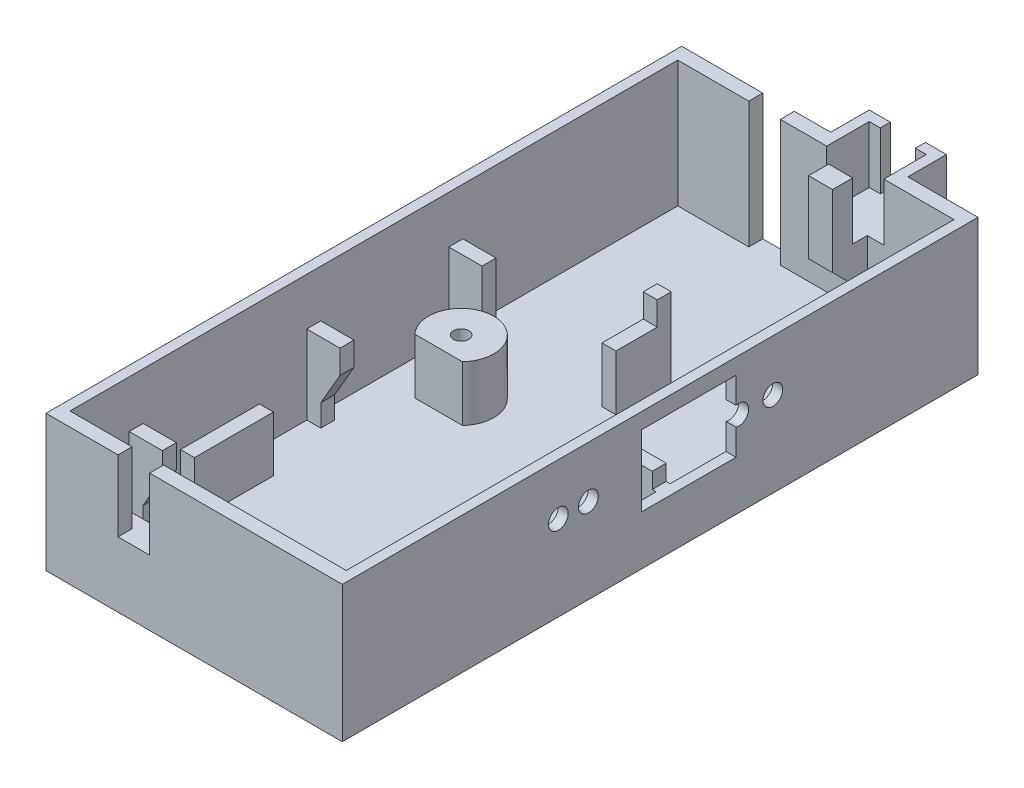
from build123d import *

# Parameters (mm, degrees)
BOSS_EXTRUDE1_DEPTH            = 77
SKETCH3_W                      = 37.54
SKETCH3_H                      = 17.27
BOSS_EXTRUDE2_DEPTH            = 1.77
SKETCH4_W                      = 37.54
SKETCH4_H                      = 17.27
BOSS_EXTRUDE3_DEPTH            = 1.77
SKETCH5_W                      = 4
SKETCH5_H                      = 16
CUT_EXTRUDE2_DEPTH             = 1.77
SKETCH6_W                      = 9.78
SKETCH6_H                      = 11.05
SKETCH6_W_2                    = 7.24
SKETCH6_H_2                    = 7.24
BUTTON_WALLS_DEPTH             = 7.24
SKETCH7_W                      = 9.78
SKETCH7_H                      = 11.05
BUTTON_BOTTOM_DEPTH            = 1.27
SKETCH8_W                      = 7.24
SKETCH8_H                      = 1.77
BUTTON_CUTOUT_MIDDLE_DEPTH     = 7.24
SKETCH9_W                      = 4.45
SKETCH9_H                      = 1.27
SKETCH9_W_2                    = 3.37
SKETCH9_H_2                    = 4.39
BUTTON_CUTOUT_FRONT_BACK_DEPTH = 7.24
SKETCH10_W                     = 3.37
SKETCH10_H                     = 4.39
BUTTON_CUTOUT_BOTTOM_DEPTH     = 1.27
BUTTON_CHAMFER1_SIZE           = 5
SKETCH12_W                     = 35
SKETCH12_H                     = 1.77
SKETCH12_W_2                   = 1.77
SKETCH12_H_2                   = 10
SKETCH12_W_3                   = 7.5
SKETCH12_R                     = 0.9652
SKETCH12_H_3                   = 7
SUPPORT_PCB_BATTERY_DEPTH      = 7
SKETCH13_R                     = 1.25
SKETCH13_W                     = 12
SKETCH13_H                     = 9
CUTOUT_USB_3_LEDS_DEPTH        = 1.77
SKETCH16_W                     = 1.77
SKETCH16_H                     = 1.77
TAB_PCB_RETAINER_LEN_DEPTH     = 3
SKETCH17_W                     = 4
SKETCH17_H                     = 1.77
CUTOUT_BACK_MOT_WIRES_DEPTH    = 9
SKETCH18_R                     = 1.25
CUTOUT_CHG_DONE_LED_DEPTH      = 10
SKETCH19_W                     = 4.2
SKETCH19_H                     = 1.77
TAB_PCB_RETAINERS_WIDTH_DEPTH  = 10
CUTOUT_RETAINER_TAB_1_DEPTH    = 1.77
CUTOUT_RETAINER_TAB_2_DEPTH    = 1.77


with BuildPart() as part:
    # Sketch2 → Boss-Extrude1 (new body)
    with BuildSketch(Plane.XY):
        Polygon((-30.215355805, 3.088014981), (-30.215355805, -12.911985019), (4.784644195, -12.911985019), (4.784644195, 3.088014981), (6.054644195, 3.088014981), (6.054644195, -14.181985019), (-31.485355805, -14.181985019), (-31.485355805, 3.088014981), align=None)
    extrude(amount=BOSS_EXTRUDE1_DEPTH)

    # Sketch3 → Boss-Extrude2 (add)
    with BuildSketch(Plane.XY.offset(77)):
        with Locations((-12.715355805, -5.546985019)):
            Rectangle(SKETCH3_W, SKETCH3_H)
    extrude(amount=BOSS_EXTRUDE2_DEPTH)

    # Sketch4 → Boss-Extrude3 (add)
    with BuildSketch(Plane(origin=(0, 0, 0), x_dir=(-1, 0, 0), z_dir=(0, 0, -1))):
        with Locations((12.715355805, -5.546985019)):
            Rectangle(SKETCH4_W, SKETCH4_H)
    extrude(amount=BOSS_EXTRUDE3_DEPTH)

    # Sketch5 → Cut-Extrude2 (cut)
    with BuildSketch(Plane(origin=(0, 0, -1.77), x_dir=(-1, 0, 0), z_dir=(0, 0, -1))):
        with Locations((19.215355805, -4.911985019)):
            Rectangle(SKETCH5_W, SKETCH5_H)
    extrude(amount=-CUT_EXTRUDE2_DEPTH, mode=Mode.SUBTRACT)

    # Sketch6 → button_walls (add)
    with BuildSketch(Plane(origin=(0, 3.088014981, 0), x_dir=(1, 0, 0), z_dir=(0, 1, 0))):
        with Locations((-7.725355805, 1.135)):
            Rectangle(SKETCH6_W, SKETCH6_H)
        with Locations((-7.725355805, 1.77)):
            Rectangle(SKETCH6_W_2, SKETCH6_H_2, mode=Mode.SUBTRACT)
    extrude(amount=-BUTTON_WALLS_DEPTH)

    # Sketch7 → button_bottom (add)
    with BuildSketch(Plane.XZ.offset(4.151985019)):
        with Locations((-7.725355805, -1.135)):
            Rectangle(SKETCH7_W, SKETCH7_H)
    extrude(amount=BUTTON_BOTTOM_DEPTH)

    # Sketch8 → button_cutout_middle (cut)
    with BuildSketch(Plane(origin=(0, 3.088014981, 0), x_dir=(1, 0, 0), z_dir=(0, 1, 0))):
        with Locations((-7.725355805, 0.885)):
            Rectangle(SKETCH8_W, SKETCH8_H)
    extrude(amount=-BUTTON_CUTOUT_MIDDLE_DEPTH, mode=Mode.SUBTRACT)

    # Sketch9 → button_cutout_front_back (cut)
    with BuildSketch(Plane(origin=(0, 3.088014981, 0), x_dir=(1, 0, 0), z_dir=(0, 1, 0))):
        with Locations((-7.720355805, 6.025)):
            Rectangle(SKETCH9_W, SKETCH9_H)
        with Locations((-10.930355805, -2.195)):
            Rectangle(SKETCH9_W_2, SKETCH9_H_2)
        with Locations((-4.520355805, -2.195)):
            Rectangle(SKETCH9_W_2, SKETCH9_H_2)
    extrude(amount=-BUTTON_CUTOUT_FRONT_BACK_DEPTH, mode=Mode.SUBTRACT)

    # Sketch10 → button_cutout_bottom (cut)
    with BuildSketch(Plane(origin=(0, -4.151985019, 0), x_dir=(1, 0, 0), z_dir=(0, 1, 0))):
        with Locations((-10.930355805, -2.195)):
            Rectangle(SKETCH10_W, SKETCH10_H)
        with Locations((-4.520355805, -2.195)):
            Rectangle(SKETCH10_W, SKETCH10_H)
    extrude(amount=-BUTTON_CUTOUT_BOTTOM_DEPTH, mode=Mode.SUBTRACT)

    # button_Chamfer1
    # the kernel refuses this chamfer: 5 mm, written as the material it adds along each edge
    with BuildSketch(Plane(origin=(-6.205355805, -5.421985019, 0), x_dir=(0, -0.9996219169112968, -0.027495876610586372), z_dir=(-1, 0, 0))) as button_chamfer1_piece_1_section:
        Polygon((BUTTON_CHAMFER1_SIZE * 0.999621916911, BUTTON_CHAMFER1_SIZE * 0.0274958766106), (-BUTTON_CHAMFER1_SIZE * 0.0274958766106, BUTTON_CHAMFER1_SIZE * 0.999621916911), (0, 0), align=None)
    button_chamfer1_piece_1 = extrude(amount=3.04, mode=Mode.PRIVATE)
    button_chamfer1_piece_1 = split(button_chamfer1_piece_1, bisect_by=Plane(origin=(-7.725355805, -7.110612501, 4.39), z_dir=(0, 0, -1)), keep=Keep.TOP, mode=Mode.PRIVATE)
    add(button_chamfer1_piece_1)

    # Sketch12 → support_pcb_battery (add)
    # profile 1 of 5: a face of its own
    with BuildSketch(Plane(origin=(0, -12.911985019, 0), x_dir=(1, 0, 0), z_dir=(0, 1, 0))):
        with Locations((-12.715355805, -76.115)):
            Rectangle(SKETCH12_W, SKETCH12_H)
    # profile 2 of 5: a face of its own
    with BuildSketch(Plane(origin=(0, -12.911985019, 0), x_dir=(1, 0, 0), z_dir=(0, 1, 0))):
        with Locations((-27.100355805, -60.23)):
            Rectangle(SKETCH12_W_2, SKETCH12_H_2)
    # profile 3 of 5: a face of its own
    with BuildSketch(Plane(origin=(0, -12.911985019, 0), x_dir=(1, 0, 0), z_dir=(0, 1, 0))):
        with Locations((1.034644195, -36.845)):
            Rectangle(SKETCH12_W_3, SKETCH12_H)
    # profile 4 of 5: a face of its own
    with BuildSketch(Plane(origin=(0, -12.911985019, 0), x_dir=(1, 0, 0), z_dir=(0, 1, 0))):
        with BuildLine():
            Line((-25.783918863, -37.73), (-19.764792747, -37.73))
            ThreePointArc((-19.764792747, -37.73), (-22.774355805, -30.7466), (-25.783918863, -37.73))
        make_face()
        with Locations(Location((-22.774355805, -34.8868, 0), (0, 0, 270))):
            Circle(SKETCH12_R, mode=Mode.SUBTRACT)
    # profile 5 of 5: a face of its own
    with BuildSketch(Plane(origin=(0, -12.911985019, 0), x_dir=(1, 0, 0), z_dir=(0, 1, 0))):
        with Locations((-12.100355805, -23.33)):
            Rectangle(SKETCH12_W_2, SKETCH12_H_3)
    extrude(amount=SUPPORT_PCB_BATTERY_DEPTH)

    # Sketch13 → cutout_usb_3_leds (cut)
    with BuildSketch(Plane(origin=(6.054644195, 0, 0), x_dir=(0, 0, -1), z_dir=(1, 0, 0))):
        with Locations((-51.3968, -3.411985019)):
            Circle(SKETCH13_R)
        with Locations((-47.5868, -3.411985019)):
            Circle(SKETCH13_R)
        with Locations((-24.2188, -3.411985019)):
            Circle(SKETCH13_R)
        with Locations((-34.8868, -3.411985019)):
            Rectangle(SKETCH13_W, SKETCH13_H)
    extrude(amount=-CUTOUT_USB_3_LEDS_DEPTH, mode=Mode.SUBTRACT)

    # Sketch16 → tab_pcb_retainer_len (add)
    with BuildSketch(Plane(origin=(0, -5.911985019, 0), x_dir=(1, 0, 0), z_dir=(0, 1, 0))):
        with Locations((-12.100355805, -20.715)):
            Rectangle(SKETCH16_W, SKETCH16_H)
    extrude(amount=TAB_PCB_RETAINER_LEN_DEPTH)

    # Sketch17 → cutout_back_mot_wires (cut)
    with BuildSketch(Plane(origin=(0, 3.088014981, 0), x_dir=(1, 0, 0), z_dir=(0, 1, 0))):
        with Locations((-20.361355805, -77.885)):
            Rectangle(SKETCH17_W, SKETCH17_H)
    extrude(amount=-CUTOUT_BACK_MOT_WIRES_DEPTH, mode=Mode.SUBTRACT)

    # Sketch18 → cutout_chg_done_led (cut)
    with BuildSketch(Plane(origin=(6.054644195, 0, 0), x_dir=(0, 0, -1), z_dir=(1, 0, 0))):
        with Locations((-28.5368, -3.411985019)):
            Circle(SKETCH18_R)
    extrude(amount=-CUTOUT_CHG_DONE_LED_DEPTH, mode=Mode.SUBTRACT)

    # Sketch19 → tab_pcb_retainers_width (add)
    with BuildSketch(Plane(origin=(0, -12.911985019, 0), x_dir=(1, 0, 0), z_dir=(0, 1, 0))):
        with Locations((-28.115355805, -68.615)):
            Rectangle(SKETCH19_W, SKETCH19_H)
        with Locations((-28.115355805, -46.115)):
            Rectangle(SKETCH19_W, SKETCH19_H)
        with Locations((-28.115355805, -28.115)):
            Rectangle(SKETCH19_W, SKETCH19_H)
    extrude(amount=TAB_PCB_RETAINERS_WIDTH_DEPTH)

    # Sketch20 → cutout_retainer_tab_1 (cut)
    with BuildSketch(Plane.XY.offset(69.5)):
        Polygon((-26.015355805, -12.911985019), (-26.015355805, -5.911985019), (-28.445355805, -10.120868481), (-28.445355805, -12.911985019), align=None)
    extrude(amount=-CUTOUT_RETAINER_TAB_1_DEPTH, mode=Mode.SUBTRACT)

    # Sketch21 → cutout_retainer_tab_2 (cut)
    with BuildSketch(Plane.XY.offset(47)):
        Polygon((-26.015355805, -5.911985019), (-28.445355805, -10.120868481), (-28.445355805, -12.911985019), (-26.015355805, -12.911985019), align=None)
    extrude(amount=-CUTOUT_RETAINER_TAB_2_DEPTH, mode=Mode.SUBTRACT)


solid = part.part
